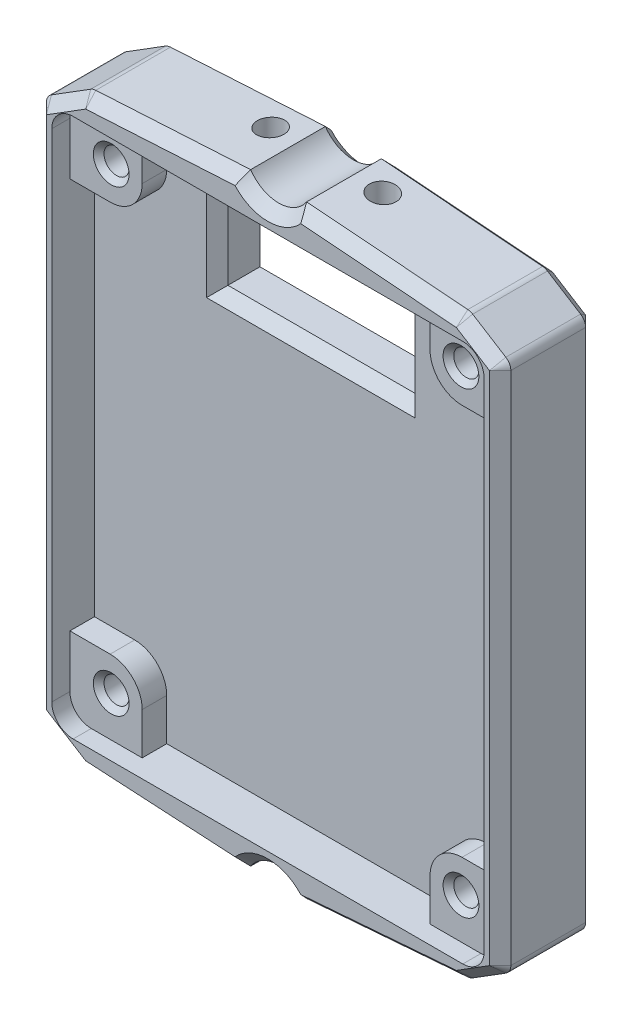
from build123d import *
from OCP.BRepFilletAPI import BRepFilletAPI_MakeChamfer

# Parameters (mm, degrees)
SKETCH1_W           = 46.5
SKETCH1_H           = 56.5
SKETCH1_W_2         = 40.5
SKETCH1_H_2         = 50.5
BOSS_EXTRUDE1_DEPTH = 4
SKETCH2_W           = 46.5
SKETCH2_H           = 56.5
BOSS_EXTRUDE2_DEPTH = 5
SKETCH3_W           = 6.769354508
SKETCH3_H           = 6.917814105
SKETCH3_R           = 1.175
BOSS_EXTRUDE3_DEPTH = 2.3
CHAMFER3_SIZE       = 4.5
CHAMFER3_SIZE2      = 7.201505381
FILLET1_R           = 3
SKETCH4_W           = 17.5
SKETCH4_H           = 10
CUT_EXTRUDE1_DEPTH  = 37.927293429
CUT_EXTRUDE2_DEPTH  = 38.677911301
SKETCH6_W           = 1.5
SKETCH6_H           = 60.377235873
CUT_EXTRUDE3_DEPTH  = 38.677911301
CUT_EXTRUDE4_START  = 30
SKETCH7_R           = 1.25
CUT_EXTRUDE4_DEPTH  = 10
FILLET2_R           = 1
CHAMFER1_SIZE       = 1
FILLET3_R           = 2
SKETCH8_R           = 1.175
CUT_EXTRUDE5_DEPTH  = 37.392706848
CUT_EXTRUDE6_DEPTH  = 1
CHAMFER2_SIZE       = 0.5


with BuildPart() as part:
    # Sketch1 → Boss-Extrude1 (new body)
    with BuildSketch(Plane.XY):
        Rectangle(SKETCH1_W, SKETCH1_H)
        Rectangle(SKETCH1_W_2, SKETCH1_H_2, mode=Mode.SUBTRACT)
    extrude(amount=BOSS_EXTRUDE1_DEPTH)

    # Sketch2 → Boss-Extrude2 (add)
    with BuildSketch(Plane(origin=(0, 0, 0), x_dir=(-1, 0, 0), z_dir=(0, 0, -1))):
        Rectangle(SKETCH2_W, SKETCH2_H)
    extrude(amount=BOSS_EXTRUDE2_DEPTH)

    # Sketch3 → Boss-Extrude3 (add)
    # profile 1 of 4: a face of its own
    with BuildSketch(Plane.XY):
        with Locations((-16.865322746, 21.791092948)):
            Rectangle(SKETCH3_W, SKETCH3_H)
        with Locations((-16.38, 21.46)):
            Circle(SKETCH3_R, mode=Mode.SUBTRACT)
    # profile 2 of 4: a face of its own
    with BuildSketch(Plane.XY):
        with Locations((16.865322746, 21.791092948)):
            Rectangle(SKETCH3_W, SKETCH3_H)
        with Locations(Location((16.38, 21.46, 0), (0, 0, 180))):
            Circle(SKETCH3_R, mode=Mode.SUBTRACT)
    # profile 3 of 4: a face of its own
    with BuildSketch(Plane.XY):
        with Locations((16.865322746, -21.791092948)):
            Rectangle(SKETCH3_W, SKETCH3_H)
        with Locations((16.38, -21.46)):
            Circle(SKETCH3_R, mode=Mode.SUBTRACT)
    # profile 4 of 4: a face of its own
    with BuildSketch(Plane.XY):
        with Locations((-16.865322746, -21.791092948)):
            Rectangle(SKETCH3_W, SKETCH3_H)
        with Locations(Location((-16.38, -21.46, 0), (0, 0, 180))):
            Circle(SKETCH3_R, mode=Mode.SUBTRACT)
    extrude(amount=BOSS_EXTRUDE3_DEPTH)

    # Chamfer3: one chamfer whose edges measure the first distance from different faces: ONE call of the kernel's chamfer builder (chamfer() names one face for all edges)
    chamfer3_edges_1 = [part.edges().sort_by_distance(p)[0] for p in [
        (23.25, 28.25, -0.5),
        (23.25, -28.25, -0.5),
    ]]
    chamfer3_side_1 = [part.faces().sort_by_distance(p)[0] for p in [
        (23.25, 0, -0.5),
    ]]
    chamfer3_edges_2 = [part.edges().sort_by_distance(p)[0] for p in [
        (-23.25, -28.25, -0.5),
        (-23.25, 28.25, -0.5),
    ]]
    chamfer3_side_2 = [part.faces().sort_by_distance(p)[0] for p in [
        (-23.25, 0, -0.5),
    ]]
    chamfer3 = BRepFilletAPI_MakeChamfer(part.part.solid().wrapped)
    for e in chamfer3_edges_1:
        chamfer3.Add(CHAMFER3_SIZE, CHAMFER3_SIZE2, e.wrapped, chamfer3_side_1[0].wrapped)  # the first distance lies on this face
    for e in chamfer3_edges_2:
        chamfer3.Add(CHAMFER3_SIZE, CHAMFER3_SIZE2, e.wrapped, chamfer3_side_2[0].wrapped)  # the first distance lies on this face
    add(Compound.cast(chamfer3.Shape()), mode=Mode.REPLACE)

    # Fillet1
    fillet1_edges = [part.edges().sort_by_distance(p)[0] for p in [
        (-13.480645492, 18.332185895, 1.15),
        (13.480645492, 18.332185895, 1.15),
        (13.480645492, -18.332185895, 1.15),
        (-13.480645492, -18.332185895, 1.15),
    ]]
    fillet(fillet1_edges, radius=FILLET1_R)

    # Sketch4 → Cut-Extrude1 (cut, through all)
    with BuildSketch(Plane.XY):
        with Locations((0, 18.8)):
            Rectangle(SKETCH4_W, SKETCH4_H)
    extrude(amount=-CUT_EXTRUDE1_DEPTH, mode=Mode.SUBTRACT)

    # Sketch5 → Cut-Extrude2 (cut, through all)
    with BuildSketch(Plane(origin=(0, 0, -5), x_dir=(-1, 0, 0), z_dir=(0, 0, -1))):
        Polygon((-23.25, -26.637996363), (-23.25, -28.25), (-16.048494619, -28.25), (-17.967727773, -27.050730023), align=None)
        with BuildLine():
            ThreePointArc((2.619160171, -28.25), (0, -26.85), (-2.619160171, -28.25))
            Line((-2.619160171, -28.25), (2.619160171, -28.25))
        make_face()
        Polygon((17.383051154, -27.416076523), (16.048494619, -28.25), (23.25, -28.25), (23.25, -27.08468784), align=None)
        Polygon((-17.967727773, -27.050730023), (-16.048494619, -28.25), (-2.619160171, -28.25), align=None)
        Polygon((17.383051154, -27.416076523), (2.619160171, -28.25), (16.048494619, -28.25), align=None)
        Polygon((-17.967727773, 27.050730023), (-2.619160171, 28.25), (-16.048494619, 28.25), align=None)
        Polygon((16.048494619, 28.25), (2.619160171, 28.25), (17.383051154, 27.416076523), align=None)
        Polygon((16.048494619, 28.25), (17.383051154, 27.416076523), (23.25, 27.08468784), (23.25, 28.25), align=None)
        Polygon((-23.25, 26.637996363), (-17.967727773, 27.050730023), (-16.048494619, 28.25), (-23.25, 28.25), align=None)
        with BuildLine():
            Line((2.619160171, 28.25), (-2.619160171, 28.25))
            ThreePointArc((-2.619160171, 28.25), (0, 26.85), (2.619160171, 28.25))
        make_face()
    extrude(amount=-CUT_EXTRUDE2_DEPTH, mode=Mode.SUBTRACT)

    # Sketch6 → Cut-Extrude3 (cut, through all)
    with BuildSketch(Plane.XY.offset(4)):
        with Locations((-22.500324405, 3.019222435)):
            Rectangle(SKETCH6_W, SKETCH6_H)
        with Locations((22.500324405, 3.019222435)):
            Rectangle(SKETCH6_W, SKETCH6_H)
    extrude(amount=-CUT_EXTRUDE3_DEPTH, mode=Mode.SUBTRACT)

    # Sketch7 → Cut-Extrude4 (cut)
    with BuildSketch(Plane(origin=(0, 0, 0), x_dir=(1, 0, 0), z_dir=(0, 1, 0)).offset(CUT_EXTRUDE4_START)):
        with Locations((-5.25, 1.5)):
            Circle(SKETCH7_R)
        with Locations(Location((5.25, 1.5, 0), (0, 0, 180))):
            Circle(SKETCH7_R)
    cut_extrude4 = extrude(amount=-CUT_EXTRUDE4_DEPTH, mode=Mode.SUBTRACT)

    # Mirror1: Cut-Extrude4 across plane
    add(cut_extrude4.mirror(Plane.ZX), mode=Mode.SUBTRACT)

    # Fillet2
    fillet2_edges = [part.edges().sort_by_distance(p)[0] for p in [
        (-17.383051154, -27.416076523, -0.5),
        (17.967727773, -27.050730023, -0.5),
        (17.967727773, 27.050730023, -0.5),
        (-17.383051154, 27.416076523, -0.5),
        (21.750324405, 24.687101317, -0.5),
        (-21.750324405, -24.687101317, -0.5),
        (-21.750324405, 24.687101317, -0.5),
        (21.750324405, -24.687101317, -0.5),
    ]]
    fillet(fillet2_edges, radius=FILLET2_R)

    # Chamfer1
    # the kernel refuses this chamfer: 1 mm, written as the material it takes off along each edge
    with BuildSketch(Plane(origin=(-8.75, 13.8, -5), x_dir=(-1, 0, 0), z_dir=(0, 1, 0)), Plane(origin=(8.75, 23.8, -5), x_dir=(1, 0, 0), z_dir=(0, -1, 0))) as chamfer1_piece_1:
        Polygon((CHAMFER1_SIZE, 0), (0, CHAMFER1_SIZE), (0, 0), align=None)
    extrude(amount=10, mode=Mode.SUBTRACT)
    with BuildSketch(Plane(origin=(-8.75, 23.8, -5), x_dir=(0, 1, 0), z_dir=(1, 0, 0)), Plane(origin=(8.75, 13.8, -5), x_dir=(0, -1, 0), z_dir=(-1, 0, 0))) as chamfer1_piece_2:
        Polygon((CHAMFER1_SIZE, 0), (0, CHAMFER1_SIZE), (0, 0), align=None)
    extrude(amount=17.5, mode=Mode.SUBTRACT)
    with BuildSketch(Plane(origin=(-8.75, 13.8, 0), x_dir=(-1, 0, 0), z_dir=(0, 1, 0)), Plane(origin=(8.75, 23.8, 0), x_dir=(1, 0, 0), z_dir=(0, -1, 0))) as chamfer1_piece_3:
        Polygon((CHAMFER1_SIZE, 0), (0, -CHAMFER1_SIZE), (0, 0), align=None)
    extrude(amount=10, mode=Mode.SUBTRACT)
    with BuildSketch(Plane(origin=(8.75, 13.8, 0), x_dir=(0, -1, 0), z_dir=(-1, 0, 0)), Plane(origin=(-8.75, 23.8, 0), x_dir=(0, 1, 0), z_dir=(1, 0, 0))) as chamfer1_piece_4:
        Polygon((CHAMFER1_SIZE, 0), (0, -CHAMFER1_SIZE), (0, 0), align=None)
    extrude(amount=17.5, mode=Mode.SUBTRACT)
    with BuildSketch(Plane(origin=(0, -30, -5), x_dir=(-0.9741455172104229, -0.2259214715312333, 0), z_dir=(0.2259214715312333, -0.9741455172104229, 0))) as chamfer1_piece_5:
        Polygon((3.15, -CHAMFER1_SIZE), (3.15 + CHAMFER1_SIZE, 0), (3.15, 0), align=None)
    revolve(axis=Axis((0, -30, -5), (0, 0, -1)), revolution_arc=206.11413982, mode=Mode.SUBTRACT)
    with BuildSketch(Plane(origin=(0, -30, 4), x_dir=(-0.9741455172104229, -0.22592147153123326, 0), z_dir=(0.22592147153123326, -0.9741455172104229, 0))) as chamfer1_piece_6:
        Polygon((3.15 + CHAMFER1_SIZE, 0), (3.15, CHAMFER1_SIZE), (3.15, 0), align=None)
    revolve(axis=Axis((0, -30, 4), (0, 0, -1)), revolution_arc=206.11413982, mode=Mode.SUBTRACT)
    with BuildSketch(Plane(origin=(0, 30, 4), x_dir=(0.9741455172104218, 0.22592147153123757, 0), z_dir=(-0.22592147153123757, 0.9741455172104218, 0))) as chamfer1_piece_7:
        Polygon((3.15 + CHAMFER1_SIZE, 0), (3.15, CHAMFER1_SIZE), (3.15, 0), align=None)
    revolve(axis=Axis((0, 30, 4), (0, 0, -1)), revolution_arc=206.11413982, mode=Mode.SUBTRACT)
    with BuildSketch(Plane(origin=(0, 30, -5), x_dir=(0.9741455172104218, 0.22592147153123757, 0), z_dir=(-0.22592147153123757, 0.9741455172104218, 0))) as chamfer1_piece_8:
        Polygon((3.15, -CHAMFER1_SIZE), (3.15 + CHAMFER1_SIZE, 0), (3.15, 0), align=None)
    revolve(axis=Axis((0, 30, -5), (0, 0, -1)), revolution_arc=206.11413982, mode=Mode.SUBTRACT)
    with BuildSketch(Plane(origin=(-21.280243669, 24.980840362, 4), x_dir=(0.5299192642332031, -0.8480480961564273, 0), z_dir=(0.8480480961564273, 0.529919264233203, 0)), Plane(origin=(-21.280243669, 24.980840362, -5), x_dir=(0, 0, 1), z_dir=(0.8480480961564273, 0.529919264233203, 0))) as chamfer1_piece_9:
        Polygon((CHAMFER1_SIZE, 0), (0, CHAMFER1_SIZE), (0, 0), align=None)
    extrude(amount=4.339034518, mode=Mode.SUBTRACT)
    with BuildSketch(Plane(origin=(-21.750324405, 24.132792266, -5), x_dir=(0, 0, 1), z_dir=(0, -1, 0)), Plane(origin=(-21.750324405, 24.132792266, 4), x_dir=(1, 0, 0), z_dir=(0, -1, 0))) as chamfer1_piece_10:
        Polygon((CHAMFER1_SIZE, 0), (0, -CHAMFER1_SIZE), (0, 0), align=None)
    extrude(amount=48.265584531, mode=Mode.SUBTRACT)
    with BuildSketch(Plane(origin=(-17.127008544, 27.430538831, -5), x_dir=(0, 0, 1), z_dir=(0.9984085863848239, 0.056394101048406226, 0)), Plane(origin=(-0.051569794, -28.39502775, -5), x_dir=(0, 0, 1), z_dir=(-0.9984085863848239, 0.05639410104840627, 0)), Plane(origin=(-17.127008544, 27.430538831, 4), x_dir=(0.056394101048406406, -0.9984085863848238, 0), z_dir=(0.9984085863848238, 0.05639410104840641, 0)), Plane(origin=(-0.051569794, -28.39502775, 4), x_dir=(0.05639410104840633, 0.9984085863848238, 0), z_dir=(-0.9984085863848238, 0.05639410104840633, 0))) as chamfer1_piece_11:
        Polygon((CHAMFER1_SIZE, 0), (0, CHAMFER1_SIZE), (0, 0), align=None)
    extrude(amount=17.10265615, mode=Mode.SUBTRACT)
    with BuildSketch(Plane(origin=(0.055291708, 28.450329474, -5), x_dir=(0, 0, 1), z_dir=(0.9969613184840543, -0.07789819925091962, 0)), Plane(origin=(17.723475622, -27.069814818, -5), x_dir=(0, 0, 1), z_dir=(-0.9969613184840543, -0.07789819925091962, 0)), Plane(origin=(17.723475622, -27.069814818, 4), x_dir=(-0.07789819925091984, 0.9969613184840543, 0), z_dir=(-0.9969613184840543, -0.07789819925091984, 0)), Plane(origin=(0.055291708, 28.450329474, 4), x_dir=(-0.07789819925091988, -0.9969613184840543, 0), z_dir=(0.9969613184840543, -0.0778981992509199, 0))) as chamfer1_piece_12:
        Polygon((CHAMFER1_SIZE, 0), (0, CHAMFER1_SIZE), (0, 0), align=None)
    extrude(amount=17.722035536, mode=Mode.SUBTRACT)
    with BuildSketch(Plane(origin=(21.280243669, 24.980840362, -5), x_dir=(0, 0, 1), z_dir=(-0.8480480961564272, 0.529919264233203, 0)), Plane(origin=(21.280243669, 24.980840362, 4), x_dir=(-0.529919264233203, -0.8480480961564272, 0), z_dir=(-0.8480480961564272, 0.529919264233203, 0))) as chamfer1_piece_13:
        Polygon((CHAMFER1_SIZE, 0), (0, -CHAMFER1_SIZE), (0, 0), align=None)
    extrude(amount=3.661050589, mode=Mode.SUBTRACT)
    with BuildSketch(Plane(origin=(21.750324405, 24.132792266, -5), x_dir=(0, 0, 1), z_dir=(0, -1, 0)), Plane(origin=(21.750324405, 24.132792266, 4), x_dir=(-1, 0, 0), z_dir=(0, -1, 0))) as chamfer1_piece_14:
        Polygon((CHAMFER1_SIZE, 0), (0, CHAMFER1_SIZE), (0, 0), align=None)
    extrude(amount=48.265584531, mode=Mode.SUBTRACT)
    with BuildSketch(Plane(origin=(21.280243669, -24.980840362, -5), x_dir=(0, 0, 1), z_dir=(-0.8480480961564274, -0.5299192642332029, 0)), Plane(origin=(21.280243669, -24.980840362, 4), x_dir=(-0.5299192642332028, 0.8480480961564273, 0), z_dir=(-0.8480480961564274, -0.5299192642332029, 0))) as chamfer1_piece_15:
        Polygon((CHAMFER1_SIZE, 0), (0, CHAMFER1_SIZE), (0, 0), align=None)
    extrude(amount=3.661050589, mode=Mode.SUBTRACT)
    with BuildSketch(Plane(origin=(-21.280243669, -24.980840362, -5), x_dir=(0, 0, 1), z_dir=(0.8480480961564274, -0.5299192642332028, 0)), Plane(origin=(-21.280243669, -24.980840362, 4), x_dir=(0.5299192642332029, 0.8480480961564274, 0), z_dir=(0.8480480961564274, -0.5299192642332028, 0))) as chamfer1_piece_16:
        Polygon((CHAMFER1_SIZE, 0), (0, -CHAMFER1_SIZE), (0, 0), align=None)
    extrude(amount=4.339034518, mode=Mode.SUBTRACT)
    with BuildSketch(Plane(origin=(20.750324405, 24.132792266, -5), x_dir=(0.5299192642332002, 0.848048096156429, 0), z_dir=(-0.848048096156429, 0.5299192642332002, 0))) as chamfer1_piece_17:
        Polygon((1, -CHAMFER1_SIZE), (1 - CHAMFER1_SIZE, 0), (1, 0), align=None)
    revolve(axis=Axis((20.750324405, 24.132792266, -5), (0, 0, -1)), revolution_arc=58, mode=Mode.SUBTRACT)
    with BuildSketch(Plane(origin=(-20.750324405, 24.132792266, -5), x_dir=(-0.5299192642332002, 0.848048096156429, 0), z_dir=(0.848048096156429, 0.5299192642332002, 0))) as chamfer1_piece_18:
        Polygon((1, CHAMFER1_SIZE), (1 - CHAMFER1_SIZE, 0), (1, 0), align=None)
    revolve(axis=Axis((-20.750324405, 24.132792266, -5), (0, 0, 1)), revolution_arc=58, mode=Mode.SUBTRACT)
    with BuildSketch(Plane(origin=(-20.750324405, -24.132792266, -5), x_dir=(-0.5299192642332002, -0.848048096156429, 0), z_dir=(0.848048096156429, -0.5299192642332002, 0))) as chamfer1_piece_19:
        Polygon((1, -CHAMFER1_SIZE), (1 - CHAMFER1_SIZE, 0), (1, 0), align=None)
    revolve(axis=Axis((-20.750324405, -24.132792266, -5), (0, 0, -1)), revolution_arc=58, mode=Mode.SUBTRACT)
    with BuildSketch(Plane(origin=(-17.070614443, -26.432130245, -5), x_dir=(-0.05639410104840442, -0.9984085863848239, 0), z_dir=(0.9984085863848239, -0.05639410104840442, 0))) as chamfer1_piece_20:
        Polygon((1, -CHAMFER1_SIZE), (1 - CHAMFER1_SIZE, 0), (1, 0), align=None)
    revolve(axis=Axis((-17.070614443, -26.432130245, -5), (0, 0, -1)), revolution_arc=28.7671409, mode=Mode.SUBTRACT)
    with BuildSketch(Plane(origin=(17.645577423, -26.0728535, -5), x_dir=(0.5299192642332029, -0.8480480961564274, 0), z_dir=(0.8480480961564274, 0.5299192642332029, 0))) as chamfer1_piece_21:
        Polygon((1, -CHAMFER1_SIZE), (1 - CHAMFER1_SIZE, 0), (1, 0), align=None)
    revolve(axis=Axis((17.645577423, -26.0728535, -5), (0, 0, -1)), revolution_arc=27.532235663, mode=Mode.SUBTRACT)
    with BuildSketch(Plane(origin=(20.750324405, -24.132792266, -5), x_dir=(1, 0, 0), z_dir=(0, 1, 0))) as chamfer1_piece_22:
        Polygon((1, -CHAMFER1_SIZE), (1 - CHAMFER1_SIZE, 0), (1, 0), align=None)
    revolve(axis=Axis((20.750324405, -24.132792266, -5), (0, 0, -1)), revolution_arc=58, mode=Mode.SUBTRACT)
    with BuildSketch(Plane(origin=(17.645577423, 26.0728535, -5), x_dir=(0.07789819925092091, 0.9969613184840542, 0), z_dir=(-0.9969613184840542, 0.07789819925092091, 0))) as chamfer1_piece_23:
        Polygon((1, -CHAMFER1_SIZE), (1 - CHAMFER1_SIZE, 0), (1, 0), align=None)
    revolve(axis=Axis((17.645577423, 26.0728535, -5), (0, 0, -1)), revolution_arc=27.532235663, mode=Mode.SUBTRACT)
    with BuildSketch(Plane(origin=(-17.070614443, 26.432130245, -5), x_dir=(-0.5299192642332029, 0.8480480961564274, 0), z_dir=(-0.8480480961564274, -0.5299192642332029, 0))) as chamfer1_piece_24:
        Polygon((1, -CHAMFER1_SIZE), (1 - CHAMFER1_SIZE, 0), (1, 0), align=None)
    revolve(axis=Axis((-17.070614443, 26.432130245, -5), (0, 0, -1)), revolution_arc=28.7671409, mode=Mode.SUBTRACT)
    with BuildSketch(Plane(origin=(20.750324405, 24.132792266, 4), x_dir=(0.5299192642332002, 0.848048096156429, 0), z_dir=(-0.848048096156429, 0.5299192642332002, 0))) as chamfer1_piece_25:
        Polygon((1 - CHAMFER1_SIZE, 0), (1, CHAMFER1_SIZE), (1, 0), align=None)
    revolve(axis=Axis((20.750324405, 24.132792266, 4), (0, 0, -1)), revolution_arc=58, mode=Mode.SUBTRACT)
    with BuildSketch(Plane(origin=(-20.750324405, 24.132792266, 4), x_dir=(-0.5299192642332002, 0.848048096156429, 0), z_dir=(0.848048096156429, 0.5299192642332002, 0))) as chamfer1_piece_26:
        Polygon((1 - CHAMFER1_SIZE, 0), (1, -CHAMFER1_SIZE), (1, 0), align=None)
    revolve(axis=Axis((-20.750324405, 24.132792266, 4), (0, 0, 1)), revolution_arc=58, mode=Mode.SUBTRACT)
    with BuildSketch(Plane(origin=(-20.750324405, -24.132792266, 4), x_dir=(-0.5299192642332029, -0.8480480961564274, 0), z_dir=(0.8480480961564274, -0.5299192642332029, 0))) as chamfer1_piece_27:
        Polygon((1 - CHAMFER1_SIZE, 0), (1, CHAMFER1_SIZE), (1, 0), align=None)
    revolve(axis=Axis((-20.750324405, -24.132792266, 4), (0, 0, -1)), revolution_arc=58, mode=Mode.SUBTRACT)
    with BuildSketch(Plane(origin=(-17.070614443, -26.432130245, 4), x_dir=(-0.05639410104840797, -0.9984085863848238, 0), z_dir=(0.9984085863848238, -0.05639410104840797, 0))) as chamfer1_piece_28:
        Polygon((1 - CHAMFER1_SIZE, 0), (1, CHAMFER1_SIZE), (1, 0), align=None)
    revolve(axis=Axis((-17.070614443, -26.432130245, 4), (0, 0, -1)), revolution_arc=28.7671409, mode=Mode.SUBTRACT)
    with BuildSketch(Plane(origin=(17.645577423, -26.0728535, 4), x_dir=(0.5299192642332029, -0.8480480961564274, 0), z_dir=(0.8480480961564274, 0.5299192642332029, 0))) as chamfer1_piece_29:
        Polygon((1 - CHAMFER1_SIZE, 0), (1, CHAMFER1_SIZE), (1, 0), align=None)
    revolve(axis=Axis((17.645577423, -26.0728535, 4), (0, 0, -1)), revolution_arc=27.532235663, mode=Mode.SUBTRACT)
    with BuildSketch(Plane(origin=(20.750324405, -24.132792266, 4), x_dir=(1, 0, 0), z_dir=(0, 1, 0))) as chamfer1_piece_30:
        Polygon((1 - CHAMFER1_SIZE, 0), (1, CHAMFER1_SIZE), (1, 0), align=None)
    revolve(axis=Axis((20.750324405, -24.132792266, 4), (0, 0, -1)), revolution_arc=58, mode=Mode.SUBTRACT)
    with BuildSketch(Plane(origin=(17.645577423, 26.0728535, 4), x_dir=(0.07789819925092091, 0.9969613184840542, 0), z_dir=(-0.9969613184840542, 0.07789819925092091, 0))) as chamfer1_piece_31:
        Polygon((1 - CHAMFER1_SIZE, 0), (1, CHAMFER1_SIZE), (1, 0), align=None)
    revolve(axis=Axis((17.645577423, 26.0728535, 4), (0, 0, -1)), revolution_arc=27.532235663, mode=Mode.SUBTRACT)
    with BuildSketch(Plane(origin=(-17.070614443, 26.432130245, 4), x_dir=(-0.5299192642332029, 0.8480480961564274, 0), z_dir=(-0.8480480961564274, -0.5299192642332029, 0))) as chamfer1_piece_32:
        Polygon((1 - CHAMFER1_SIZE, 0), (1, CHAMFER1_SIZE), (1, 0), align=None)
    revolve(axis=Axis((-17.070614443, 26.432130245, 4), (0, 0, -1)), revolution_arc=28.7671409, mode=Mode.SUBTRACT)
    with BuildSketch(Plane(origin=(-8.75, 11.228317012, -5), x_dir=(-1, 0, 0), z_dir=(0, 1, 0))) as chamfer1_piece_33a_section:
        Polygon((CHAMFER1_SIZE, 0), (0, CHAMFER1_SIZE), (0, 0), align=None)
    chamfer1_piece_33a = extrude(amount=12.571682988, mode=Mode.PRIVATE)
    chamfer1_piece_33a = split(chamfer1_piece_33a, bisect_by=Plane(origin=(-8.75, 13.8, -5), z_dir=(0, -1, 0)), keep=Keep.TOP, mode=Mode.PRIVATE)
    with BuildSketch(Plane(origin=(8.75, 13.8, -5), x_dir=(0, -1, 0), z_dir=(-1, 0, 0))) as chamfer1_piece_33b_section:
        Polygon((CHAMFER1_SIZE, 0), (0, CHAMFER1_SIZE), (0, 0), align=None)
    chamfer1_piece_33b = extrude(amount=20.071682988, mode=Mode.PRIVATE)
    chamfer1_piece_33b = split(chamfer1_piece_33b, bisect_by=Plane(origin=(-8.75, 13.8, -5), z_dir=(-1, 0, 0)), keep=Keep.TOP, mode=Mode.PRIVATE)
    chamfer1_piece_33 = chamfer1_piece_33a & chamfer1_piece_33b
    add(chamfer1_piece_33, mode=Mode.SUBTRACT)
    with BuildSketch(Plane(origin=(-8.75, 13.8, -5), x_dir=(-1, 0, 0), z_dir=(0, 1, 0))) as chamfer1_piece_34a_section:
        Polygon((CHAMFER1_SIZE, 0), (0, CHAMFER1_SIZE), (0, 0), align=None)
    chamfer1_piece_34a = extrude(amount=12.571682988, mode=Mode.PRIVATE)
    chamfer1_piece_34a = split(chamfer1_piece_34a, bisect_by=Plane(origin=(-8.75, 23.8, -5), z_dir=(0, 1, 0)), keep=Keep.TOP, mode=Mode.PRIVATE)
    with BuildSketch(Plane(origin=(-11.321682988, 23.8, -5), x_dir=(0, 1, 0), z_dir=(1, 0, 0))) as chamfer1_piece_34b_section:
        Polygon((CHAMFER1_SIZE, 0), (0, CHAMFER1_SIZE), (0, 0), align=None)
    chamfer1_piece_34b = extrude(amount=20.071682988, mode=Mode.PRIVATE)
    chamfer1_piece_34b = split(chamfer1_piece_34b, bisect_by=Plane(origin=(-8.75, 23.8, -5), z_dir=(-1, 0, 0)), keep=Keep.TOP, mode=Mode.PRIVATE)
    chamfer1_piece_34 = chamfer1_piece_34a & chamfer1_piece_34b
    add(chamfer1_piece_34, mode=Mode.SUBTRACT)
    with BuildSketch(Plane(origin=(-8.75, 23.8, -5), x_dir=(0, 1, 0), z_dir=(1, 0, 0))) as chamfer1_piece_35a_section:
        Polygon((CHAMFER1_SIZE, 0), (0, CHAMFER1_SIZE), (0, 0), align=None)
    chamfer1_piece_35a = extrude(amount=20.071682988, mode=Mode.PRIVATE)
    chamfer1_piece_35a = split(chamfer1_piece_35a, bisect_by=Plane(origin=(8.75, 23.8, -5), z_dir=(1, 0, 0)), keep=Keep.TOP, mode=Mode.PRIVATE)
    with BuildSketch(Plane(origin=(8.75, 26.371682988, -5), x_dir=(1, 0, 0), z_dir=(0, -1, 0))) as chamfer1_piece_35b_section:
        Polygon((CHAMFER1_SIZE, 0), (0, CHAMFER1_SIZE), (0, 0), align=None)
    chamfer1_piece_35b = extrude(amount=12.571682988, mode=Mode.PRIVATE)
    chamfer1_piece_35b = split(chamfer1_piece_35b, bisect_by=Plane(origin=(8.75, 23.8, -5), z_dir=(0, 1, 0)), keep=Keep.TOP, mode=Mode.PRIVATE)
    chamfer1_piece_35 = chamfer1_piece_35a & chamfer1_piece_35b
    add(chamfer1_piece_35, mode=Mode.SUBTRACT)
    with BuildSketch(Plane(origin=(11.321682988, 13.8, -5), x_dir=(0, -1, 0), z_dir=(-1, 0, 0))) as chamfer1_piece_36a_section:
        Polygon((CHAMFER1_SIZE, 0), (0, CHAMFER1_SIZE), (0, 0), align=None)
    chamfer1_piece_36a = extrude(amount=20.071682988, mode=Mode.PRIVATE)
    chamfer1_piece_36a = split(chamfer1_piece_36a, bisect_by=Plane(origin=(8.75, 13.8, -5), z_dir=(1, 0, 0)), keep=Keep.TOP, mode=Mode.PRIVATE)
    with BuildSketch(Plane(origin=(8.75, 23.8, -5), x_dir=(1, 0, 0), z_dir=(0, -1, 0))) as chamfer1_piece_36b_section:
        Polygon((CHAMFER1_SIZE, 0), (0, CHAMFER1_SIZE), (0, 0), align=None)
    chamfer1_piece_36b = extrude(amount=12.571682988, mode=Mode.PRIVATE)
    chamfer1_piece_36b = split(chamfer1_piece_36b, bisect_by=Plane(origin=(8.75, 13.8, -5), z_dir=(0, -1, 0)), keep=Keep.TOP, mode=Mode.PRIVATE)
    chamfer1_piece_36 = chamfer1_piece_36a & chamfer1_piece_36b
    add(chamfer1_piece_36, mode=Mode.SUBTRACT)
    with BuildSketch(Plane(origin=(-8.75, 11.228317012, 0), x_dir=(-1, 0, 0), z_dir=(0, 1, 0))) as chamfer1_piece_37a_section:
        Polygon((CHAMFER1_SIZE, 0), (0, -CHAMFER1_SIZE), (0, 0), align=None)
    chamfer1_piece_37a = extrude(amount=12.571682988, mode=Mode.PRIVATE)
    chamfer1_piece_37a = split(chamfer1_piece_37a, bisect_by=Plane(origin=(-8.75, 13.8, 0), z_dir=(0, -1, 0)), keep=Keep.TOP, mode=Mode.PRIVATE)
    with BuildSketch(Plane(origin=(8.75, 13.8, 0), x_dir=(0, -1, 0), z_dir=(-1, 0, 0))) as chamfer1_piece_37b_section:
        Polygon((CHAMFER1_SIZE, 0), (0, -CHAMFER1_SIZE), (0, 0), align=None)
    chamfer1_piece_37b = extrude(amount=20.071682988, mode=Mode.PRIVATE)
    chamfer1_piece_37b = split(chamfer1_piece_37b, bisect_by=Plane(origin=(-8.75, 13.8, 0), z_dir=(-1, 0, 0)), keep=Keep.TOP, mode=Mode.PRIVATE)
    chamfer1_piece_37 = chamfer1_piece_37a & chamfer1_piece_37b
    add(chamfer1_piece_37, mode=Mode.SUBTRACT)
    with BuildSketch(Plane(origin=(-8.75, 13.8, 0), x_dir=(-1, 0, 0), z_dir=(0, 1, 0))) as chamfer1_piece_38a_section:
        Polygon((CHAMFER1_SIZE, 0), (0, -CHAMFER1_SIZE), (0, 0), align=None)
    chamfer1_piece_38a = extrude(amount=12.571682988, mode=Mode.PRIVATE)
    chamfer1_piece_38a = split(chamfer1_piece_38a, bisect_by=Plane(origin=(-8.75, 25.25, 0), z_dir=(0, -1, 0)), keep=Keep.TOP, mode=Mode.PRIVATE)
    chamfer1_piece_38a = split(chamfer1_piece_38a, bisect_by=Plane(origin=(-8.75, 23.8, 0), z_dir=(0, 1, 0)), keep=Keep.TOP, mode=Mode.PRIVATE)
    with BuildSketch(Plane(origin=(-11.321682988, 23.8, 0), x_dir=(0, 1, 0), z_dir=(1, 0, 0))) as chamfer1_piece_38b_section:
        Polygon((CHAMFER1_SIZE, 0), (0, -CHAMFER1_SIZE), (0, 0), align=None)
    chamfer1_piece_38b = extrude(amount=20.071682988, mode=Mode.PRIVATE)
    chamfer1_piece_38b = split(chamfer1_piece_38b, bisect_by=Plane(origin=(-8.75, 23.8, 0), z_dir=(-1, 0, 0)), keep=Keep.TOP, mode=Mode.PRIVATE)
    chamfer1_piece_38 = chamfer1_piece_38a & chamfer1_piece_38b
    add(chamfer1_piece_38, mode=Mode.SUBTRACT)
    with BuildSketch(Plane(origin=(11.321682988, 13.8, 0), x_dir=(0, -1, 0), z_dir=(-1, 0, 0))) as chamfer1_piece_39a_section:
        Polygon((CHAMFER1_SIZE, 0), (0, -CHAMFER1_SIZE), (0, 0), align=None)
    chamfer1_piece_39a = extrude(amount=20.071682988, mode=Mode.PRIVATE)
    chamfer1_piece_39a = split(chamfer1_piece_39a, bisect_by=Plane(origin=(8.75, 13.8, 0), z_dir=(1, 0, 0)), keep=Keep.TOP, mode=Mode.PRIVATE)
    with BuildSketch(Plane(origin=(8.75, 23.8, 0), x_dir=(1, 0, 0), z_dir=(0, -1, 0))) as chamfer1_piece_39b_section:
        Polygon((CHAMFER1_SIZE, 0), (0, -CHAMFER1_SIZE), (0, 0), align=None)
    chamfer1_piece_39b = extrude(amount=12.571682988, mode=Mode.PRIVATE)
    chamfer1_piece_39b = split(chamfer1_piece_39b, bisect_by=Plane(origin=(8.75, 13.8, 0), z_dir=(0, -1, 0)), keep=Keep.TOP, mode=Mode.PRIVATE)
    chamfer1_piece_39 = chamfer1_piece_39a & chamfer1_piece_39b
    add(chamfer1_piece_39, mode=Mode.SUBTRACT)
    with BuildSketch(Plane(origin=(8.75, 26.371682988, 0), x_dir=(1, 0, 0), z_dir=(0, -1, 0))) as chamfer1_piece_40a_section:
        Polygon((CHAMFER1_SIZE, 0), (0, -CHAMFER1_SIZE), (0, 0), align=None)
    chamfer1_piece_40a = extrude(amount=12.571682988, mode=Mode.PRIVATE)
    chamfer1_piece_40a = split(chamfer1_piece_40a, bisect_by=Plane(origin=(8.75, 25.25, 0), z_dir=(0, -1, 0)), keep=Keep.TOP, mode=Mode.PRIVATE)
    chamfer1_piece_40a = split(chamfer1_piece_40a, bisect_by=Plane(origin=(8.75, 23.8, 0), z_dir=(0, 1, 0)), keep=Keep.TOP, mode=Mode.PRIVATE)
    with BuildSketch(Plane(origin=(-8.75, 23.8, 0), x_dir=(0, 1, 0), z_dir=(1, 0, 0))) as chamfer1_piece_40b_section:
        Polygon((CHAMFER1_SIZE, 0), (0, -CHAMFER1_SIZE), (0, 0), align=None)
    chamfer1_piece_40b = extrude(amount=20.071682988, mode=Mode.PRIVATE)
    chamfer1_piece_40b = split(chamfer1_piece_40b, bisect_by=Plane(origin=(8.75, 23.8, 0), z_dir=(1, 0, 0)), keep=Keep.TOP, mode=Mode.PRIVATE)
    chamfer1_piece_40 = chamfer1_piece_40a & chamfer1_piece_40b
    add(chamfer1_piece_40, mode=Mode.SUBTRACT)

    # Fillet3
    # the kernel refuses this fillet: 2 mm, written as the material it adds along each edge
    with BuildSketch(Plane(origin=(-20.25, -25.25, -2.7), x_dir=(1, 0, 0), z_dir=(0, 0, 1))) as fillet3_piece_1_section:
        with BuildLine():
            CenterArc((FILLET3_R, FILLET3_R), FILLET3_R, 180, 90)
            Line((0, FILLET3_R), (0, 0))
            Line((0, 0), (FILLET3_R, 0))
        make_face()
    fillet3_piece_1 = extrude(amount=11.017685648, mode=Mode.PRIVATE)
    fillet3_piece_1 = split(fillet3_piece_1, bisect_by=Plane(origin=(-20.25, -25.25, 4), z_dir=(0, 0, -1)), keep=Keep.TOP, mode=Mode.PRIVATE)
    fillet3_piece_1 = split(fillet3_piece_1, bisect_by=Plane(origin=(-21.844443776, -27.801643429, 0.308842824), z_dir=(0.3747095052207162, 0.5996605595645308, -0.7071067811865475)), keep=Keep.TOP, mode=Mode.PRIVATE)
    add(fillet3_piece_1)
    with BuildSketch(Plane(origin=(20.25, -25.25, -2.7), x_dir=(0, 1, 0), z_dir=(0, 0, 1))) as fillet3_piece_2_section:
        with BuildLine():
            CenterArc((FILLET3_R, FILLET3_R), FILLET3_R, 180, 90)
            Line((0, FILLET3_R), (0, 0))
            Line((0, 0), (FILLET3_R, 0))
        make_face()
    fillet3_piece_2 = extrude(amount=11.017685648, mode=Mode.PRIVATE)
    fillet3_piece_2 = split(fillet3_piece_2, bisect_by=Plane(origin=(20.25, -25.25, 4), z_dir=(0, 0, -1)), keep=Keep.TOP, mode=Mode.PRIVATE)
    fillet3_piece_2 = split(fillet3_piece_2, bisect_by=Plane(origin=(21.844443776, -27.801643429, 0.308842824), z_dir=(-0.37470950522071644, 0.5996605595645308, -0.7071067811865477)), keep=Keep.TOP, mode=Mode.PRIVATE)
    add(fillet3_piece_2)
    with BuildSketch(Plane(origin=(20.25, 25.25, -2.7), x_dir=(0, -1, 0), z_dir=(0, 0, 1))) as fillet3_piece_3_section:
        with BuildLine():
            CenterArc((FILLET3_R, -FILLET3_R), FILLET3_R, 90, 90)
            Line((0, -FILLET3_R), (0, 0))
            Line((0, 0), (FILLET3_R, 0))
        make_face()
    fillet3_piece_3 = extrude(amount=11.017685648, mode=Mode.PRIVATE)
    fillet3_piece_3 = split(fillet3_piece_3, bisect_by=Plane(origin=(20.25, 25.25, 4), z_dir=(0, 0, -1)), keep=Keep.TOP, mode=Mode.PRIVATE)
    fillet3_piece_3 = split(fillet3_piece_3, bisect_by=Plane(origin=(21.844443776, 27.801643429, 0.308842824), z_dir=(-0.37470950522071644, -0.5996605595645308, -0.7071067811865477)), keep=Keep.TOP, mode=Mode.PRIVATE)
    add(fillet3_piece_3)
    with BuildSketch(Plane(origin=(-20.25, 25.25, -2.7), x_dir=(0, -1, 0), z_dir=(0, 0, 1))) as fillet3_piece_4_section:
        with BuildLine():
            CenterArc((FILLET3_R, FILLET3_R), FILLET3_R, 180, 90)
            Line((0, FILLET3_R), (0, 0))
            Line((0, 0), (FILLET3_R, 0))
        make_face()
    fillet3_piece_4 = extrude(amount=11.017685648, mode=Mode.PRIVATE)
    fillet3_piece_4 = split(fillet3_piece_4, bisect_by=Plane(origin=(-21.844443776, 27.801643429, 0.308842824), z_dir=(0.3747095052207162, -0.5996605595645308, -0.7071067811865475)), keep=Keep.TOP, mode=Mode.PRIVATE)
    fillet3_piece_4 = split(fillet3_piece_4, bisect_by=Plane(origin=(-20.25, 25.25, 4), z_dir=(0, 0, -1)), keep=Keep.TOP, mode=Mode.PRIVATE)
    add(fillet3_piece_4)

    # Sketch8 → Cut-Extrude5 (cut, through all)
    with BuildSketch(Plane.XY.offset(2.3)):
        with Locations((-16.38, 21.46)):
            Circle(SKETCH8_R)
        with Locations(Location((16.38, 21.46, 0), (0, 0, 180))):
            Circle(SKETCH8_R)
        with Locations((16.38, -21.46)):
            Circle(SKETCH8_R)
        with Locations(Location((-16.38, -21.46, 0), (0, 0, 180))):
            Circle(SKETCH8_R)
    extrude(amount=-CUT_EXTRUDE5_DEPTH, mode=Mode.SUBTRACT)

    # Sketch9 → Cut-Extrude6 (cut)
    with BuildSketch(Plane(origin=(0, 0, -5), x_dir=(-1, 0, 0), z_dir=(0, 0, -1))):
        with BuildLine():
            Line((-16.374158343, -2.036488248), (-6.384848004, -2.036488248))
            ThreePointArc((-6.384848004, -2.036488248), (-1.5, -2.786488248), (-6.384848004, -3.536488248))
            Line((-6.384848004, -3.536488248), (-12.618681454, -3.536488248))
            Line((-12.618681454, -3.536488248), (0, -15.530095236))
            Line((0, -15.530095236), (12.618681454, -3.536488248))
            Line((12.618681454, -3.536488248), (6.384848004, -3.536488248))
            ThreePointArc((6.384848004, -3.536488248), (1.5, -2.786488248), (6.384848004, -2.036488248))
            Line((6.384848004, -2.036488248), (16.374158343, -2.036488248))
            Line((16.374158343, -2.036488248), (0, -17.599542173))
            Line((0, -17.599542173), (-16.374158343, -2.036488248))
        make_face()
    extrude(amount=-CUT_EXTRUDE6_DEPTH, mode=Mode.SUBTRACT)

    # Chamfer2
    chamfer2_edges = [part.edges().sort_by_distance(p)[0] for p in [
        (-17.555, 21.46, 2.3),
        (17.555, 21.46, 2.3),
        (15.205, -21.46, 2.3),
        (-15.205, -21.46, 2.3),
    ]]
    chamfer(chamfer2_edges, length=CHAMFER2_SIZE)


solid = part.part
